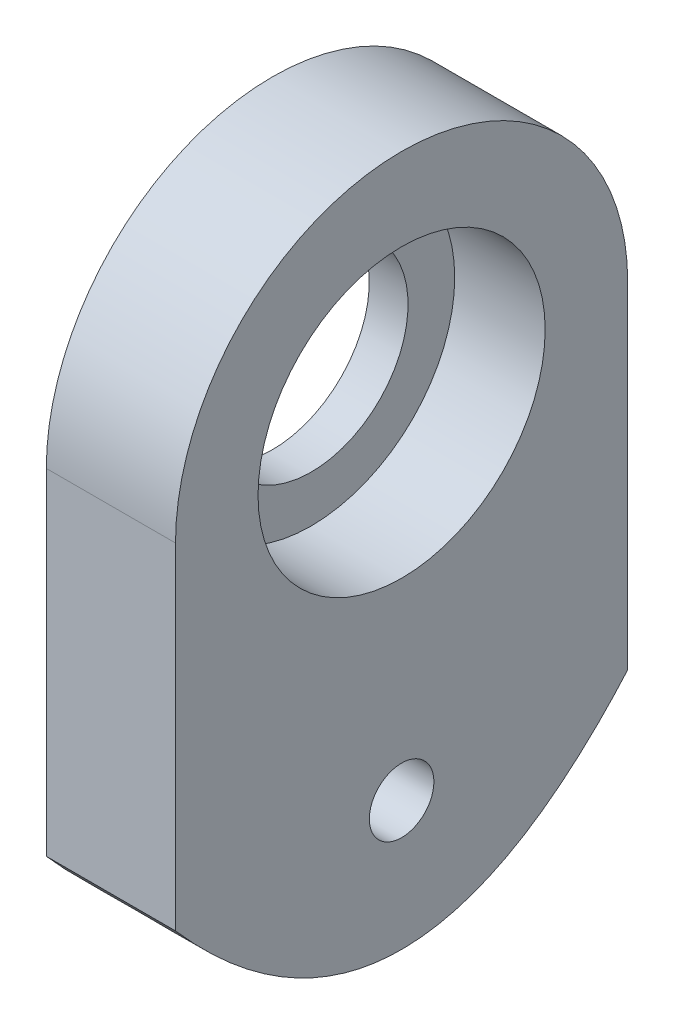
from build123d import *

# Parameters (mm, degrees)
CROQUIS1_R              = 2.5
SALIENTE_EXTRUIR2_DEPTH = 10
CROQUIS2_R              = 17.5
CROQUIS2_R_2            = 11.1125
SALIENTE_EXTRUIR3_DEPTH = 10
CROQUIS3_R              = 11.1125
CORTAR_EXTRUIR1_DEPTH   = 10
CROQUIS4_R              = 11.1125
CROQUIS4_R_2            = 7.5
SALIENTE_EXTRUIR4_DEPTH = 3


with BuildPart() as part:
    # Croquis1 → Saliente-Extruir2 (new body)
    with BuildSketch(Plane(origin=(0, 0, 0), x_dir=(0, 0, -1), z_dir=(1, 0, 0))):
        with BuildLine():
            Line((17.5, -26), (17.5, 0))
            ThreePointArc((17.5, 0), (0, 17.5), (-17.5, 0))
            Line((-17.5, 0), (-17.5, -26))
            add(Edge.make_bspline(
                [(-17.5, -26), (0, -46), (17.5, -26)],
                knots=[0, 0, 0, 1, 1, 1], degree=2))
        make_face()
        with Locations((0, -26)):
            Circle(CROQUIS1_R, mode=Mode.SUBTRACT)
        with BuildLine():
            Line((-13.783729421, -3.874119675), (-3.536778655, 13.874119675))
            ThreePointArc((-3.536778655, 13.874119675), (-2.922822403, 14.532391234), (-2.082378285, 14.854753471))
            ThreePointArc((-2.082378285, 14.854753471), (0, 15), (2.082378285, 14.854753471))
            ThreePointArc((2.082378285, 14.854753471), (2.922822403, 14.532391234), (3.536778655, 13.874119675))
            Line((3.536778655, 13.874119675), (13.783729421, -3.874119675))
            ThreePointArc((13.783729421, -3.874119675), (14.046831188, -4.734957166), (13.905783015, -5.62398424))
            ThreePointArc((13.905783015, -5.62398424), (12.990381057, -7.5), (11.82340473, -9.230769231))
            ThreePointArc((11.82340473, -9.230769231), (11.124008785, -9.797434069), (10.246950766, -10))
            Line((10.246950766, -10), (-10.246950766, -10))
            ThreePointArc((-10.246950766, -10), (-11.124008785, -9.797434069), (-11.82340473, -9.230769231))
            ThreePointArc((-11.82340473, -9.230769231), (-12.990381057, -7.5), (-13.905783015, -5.62398424))
            ThreePointArc((-13.905783015, -5.62398424), (-14.046831188, -4.734957166), (-13.783729421, -3.874119675))
        make_face(mode=Mode.SUBTRACT)
    extrude(amount=SALIENTE_EXTRUIR2_DEPTH)

    # Croquis2 → Saliente-Extruir3 (add)
    with BuildSketch(Plane.ZY):
        Circle(CROQUIS2_R)
        Circle(CROQUIS2_R_2, mode=Mode.SUBTRACT)
    extrude(amount=-SALIENTE_EXTRUIR3_DEPTH)

    # Croquis3 → Cortar-Extruir1 (cut)
    with BuildSketch(Plane.ZY):
        Circle(CROQUIS3_R)
    extrude(amount=-CORTAR_EXTRUIR1_DEPTH, mode=Mode.SUBTRACT)

    # Croquis4 → Saliente-Extruir4 (add)
    with BuildSketch(Plane.ZY):
        Circle(CROQUIS4_R)
        Circle(CROQUIS4_R_2, mode=Mode.SUBTRACT)
    extrude(amount=-SALIENTE_EXTRUIR4_DEPTH)


solid = part.part
